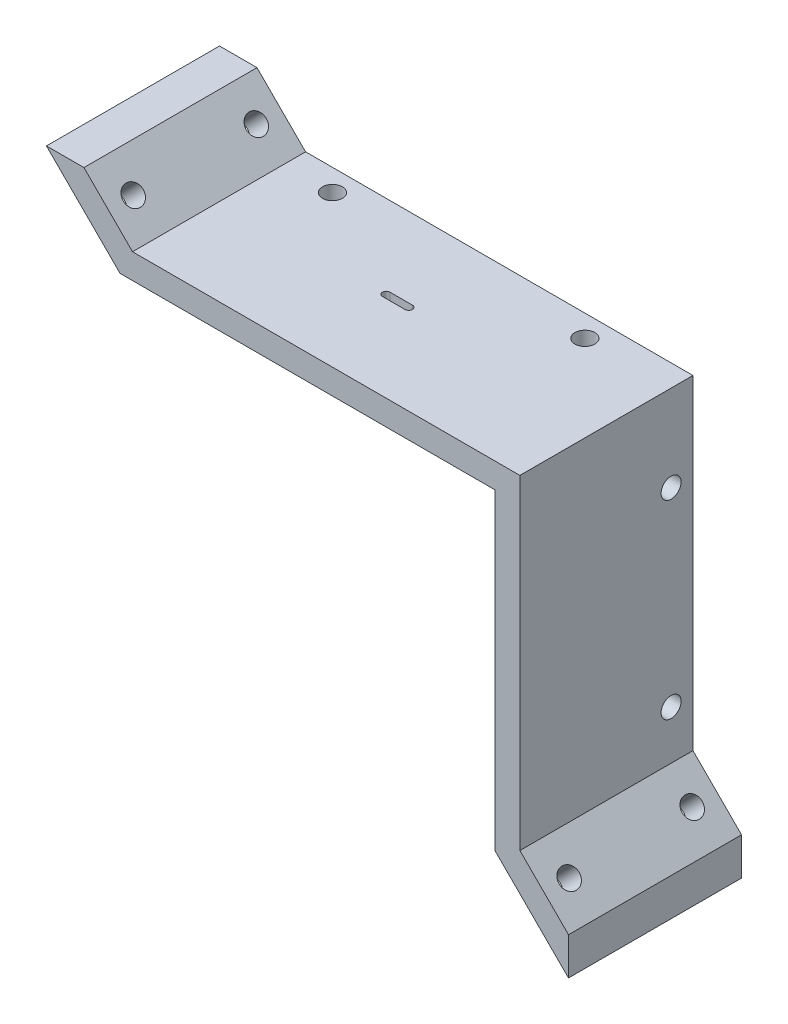
from build123d import *

# Parameters (mm, degrees)
BOSS_EXTRUDE1_DEPTH     = 27.7
SKETCH2_R               = 1.6
CUT_EXTRUDE1_DEPTH      = 6.4
MIRROR1_START           = 25
MIRROR1_OUTLINE_R       = 1.6
MIRROR1_DEPTH           = 4
BOSS_EXTRUDE2_DEPTH     = 27.7
CUT_EXTRUDE2_DEPTH      = 8
CUT_EXTRUDE2_DEPTH_BACK = 8
SKETCH4_R               = 1.6
CUT_EXTRUDE3_DEPTH      = 8


# Read off the part's stored shape, not the designer's step: Mirror1
with BuildPart() as part:
    # Sketch1 → Boss-Extrude1 (new body)
    with BuildSketch(Plane.XY):
        Polygon((-34, 29), (34, 29), (34, -29), (30, -25), (30, 25), (-30, 25), align=None)
    extrude(amount=BOSS_EXTRUDE1_DEPTH)

    # Sketch2 → Cut-Extrude1 (cut)
    with BuildSketch(Plane(origin=(34, 0, 0), x_dir=(0, 0, -1), z_dir=(1, 0, 0))):
        with Locations((-3.5, -15.2)):
            Circle(SKETCH2_R)
        with Locations((-3.5, 15.2)):
            Circle(SKETCH2_R)
    extrude(amount=-CUT_EXTRUDE1_DEPTH, mode=Mode.SUBTRACT)

    # Mirror1 outline → Mirror1 (cut)
    with BuildSketch(Plane(origin=(0, 0, 0), x_dir=(1, 0, 0), z_dir=(0, 1, 0)).offset(MIRROR1_START)):
        with Locations((20.2, -3.5)):
            Circle(MIRROR1_OUTLINE_R)
    mirror1 = extrude(amount=MIRROR1_DEPTH, mode=Mode.SUBTRACT)

    # Mirror2: Mirror1 across plane
    add(mirror1.mirror(Plane(origin=(0, 0, 0), x_dir=(0, 0, 1), z_dir=(1, 0, 0))), mode=Mode.SUBTRACT)

    # Sketch3 → Boss-Extrude2 (add)
    with BuildSketch(Plane.XY.offset(27.7)):
        Polygon((-34, 29), (-41.778174593, 36.778174593), (-35.778174593, 36.778174593), (-28, 29), align=None)
        Polygon((34, -29), (41.778174593, -36.778174593), (41.778174593, -30.778174593), (34, -23), align=None)
    extrude(amount=-BOSS_EXTRUDE2_DEPTH)

    # Sketch4 → Cut-Extrude2 (cut, two sides: drawn at the far end of the back side and taken through both)
    with BuildSketch(Plane(origin=(0.5, 0.5, 0), x_dir=(0, 0, -1), z_dir=(0.7071067811865475, 0.7071067811865477, 0)).offset(-CUT_EXTRUDE2_DEPTH_BACK)):
        with Locations(Location((-4, 45.805086528, 0), (0, 0, 90))):
            Circle(SKETCH4_R)
        with Locations(Location((-23.7, 45.805086528, 0), (0, 0, 90))):
            Circle(SKETCH4_R)
        with Locations(Location((-23.7, -45.794913472, 0), (0, 0, 90))):
            Circle(SKETCH4_R)
        with Locations(Location((-4, -45.794913472, 0), (0, 0, 90))):
            Circle(SKETCH4_R)
    extrude(amount=CUT_EXTRUDE2_DEPTH + CUT_EXTRUDE2_DEPTH_BACK, mode=Mode.SUBTRACT)

    # Sketch5 → Cut-Extrude3 (cut)
    with BuildSketch(Plane.XZ.offset(-25)):
        with BuildLine():
            Line((-1.8, 13.9), (1.8, 13.9))
            ThreePointArc((1.8, 13.9), (2.4, 13.3), (1.8, 12.7))
            Line((1.8, 12.7), (-1.8, 12.7))
            ThreePointArc((-1.8, 12.7), (-2.4, 13.3), (-1.8, 13.9))
        make_face()
    extrude(amount=-CUT_EXTRUDE3_DEPTH, mode=Mode.SUBTRACT)


solid = part.part
